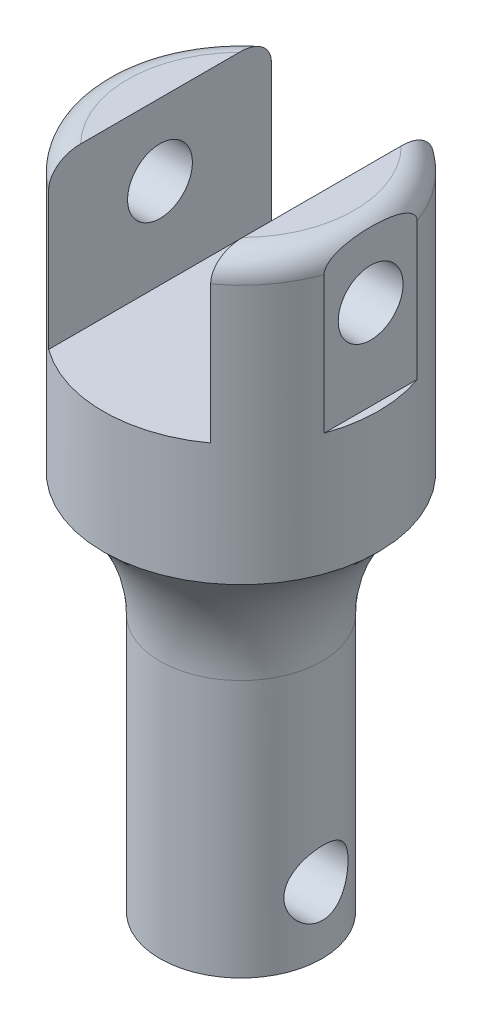
from build123d import *

# Parameters (mm, degrees)
EXTRUDE_START       = -15
SKETCH_1_R          = 17
EXTRUDE_1_DEPTH     = 35
SKETCH_2_R          = 10
EXTRUDE_2_DEPTH     = 47
FILLET_3_R          = 3
FILLET_4_R          = 20
SKETCH_4_W          = 20
SKETCH_4_H          = 21.133558335
CUT_EXTRUDE_2_DEPTH = 35
SKETCH_5_R          = 4
CUT_EXTRUDE_3_DEPTH = 35
CUT_EXTRUDE_START   = 20
SKETCH_6_W          = 15
SKETCH_6_H          = 20.573480962
CUT_EXTRUDE_4_DEPTH = 4
CUT_EXTRUDE_START_2 = -20
SKETCH_7_W          = 20
SKETCH_7_H          = 18.159164137
CUT_EXTRUDE_5_DEPTH = 4
SKETCH_8_R          = 4
CUT_EXTRUDE_6_DEPTH = 35


with BuildPart() as part:
    # Эскиз1 → Вытянуть1 (new body)
    with BuildSketch(Plane(origin=(0, 0, 0), x_dir=(1, 0, 0), z_dir=(0, 1, 0)).offset(EXTRUDE_START)):
        with Locations(Location((0, 0, 0), (0, 0, 270))):
            Circle(SKETCH_1_R)
    extrude(amount=EXTRUDE_1_DEPTH)

    # Эскиз2 → Вытянуть2 (add)
    with BuildSketch(Plane.XZ.offset(15)):
        with Locations(Location((0, 0, 0), (0, 0, 90))):
            Circle(SKETCH_2_R)
    extrude(amount=EXTRUDE_2_DEPTH)

    # Скругление3
    fillet_3_edges = [part.edges().sort_by_distance(p)[0] for p in [
        (0, 20, -17),
    ]]
    fillet(fillet_3_edges, radius=FILLET_3_R)

    # Скругление4
    # the kernel refuses this fillet: 20 mm, written as the material it adds along each edge
    with BuildSketch(Plane(origin=(0, -15, 0), x_dir=(0, 0, 1), z_dir=(1, 0, 0))) as fillet_4_piece_1:
        with BuildLine():
            CenterArc((30, 15.198684154), FILLET_4_R, 180, 49.458398126)
            Line((10, 15.198684154), (9.6, 15.198684154))
            Line((9.6, 15.198684154), (9.6, 0))
            Line((9.6, 0), (10, -0.4))
            ThreePointArc((10, -0.4), (13.5, -0.4), (16.74, -0.303973683))
            Line((16.74, -0.303973683), (17, 0))
        make_face()
    revolve(axis=Axis((0, -15, 0), (0, -1, 0)))

    # Эскиз4 → Вырез-Вытянуть2 (cut, symmetric)
    with BuildSketch(Plane.XY):
        with Locations((0, 10.566779168)):
            Rectangle(SKETCH_4_W, SKETCH_4_H)
    extrude(amount=CUT_EXTRUDE_2_DEPTH, both=True, mode=Mode.SUBTRACT)

    # Эскиз5 → Вырез-Вытянуть3 (cut, symmetric)
    with BuildSketch(Plane(origin=(0, 0, 0), x_dir=(0, 0, -1), z_dir=(1, 0, 0))):
        with Locations((0, 11.128860454)):
            Circle(SKETCH_5_R)
    extrude(amount=CUT_EXTRUDE_3_DEPTH, both=True, mode=Mode.SUBTRACT)

    # Эскиз6 → Вырез-Вытянуть4 (cut)
    with BuildSketch(Plane(origin=(0, 0, 0), x_dir=(0, 0, -1), z_dir=(1, 0, 0)).offset(CUT_EXTRUDE_START)):
        with Locations((0, 10.338040732)):
            Rectangle(SKETCH_6_W, SKETCH_6_H)
    extrude(amount=-CUT_EXTRUDE_4_DEPTH, mode=Mode.SUBTRACT)

    # Эскиз7 → Вырез-Вытянуть5 (cut)
    with BuildSketch(Plane(origin=(0, 0, 0), x_dir=(0, 0, -1), z_dir=(1, 0, 0)).offset(CUT_EXTRUDE_START_2)):
        with Locations((0, 11.708442525)):
            Rectangle(SKETCH_7_W, SKETCH_7_H)
    extrude(amount=CUT_EXTRUDE_5_DEPTH, mode=Mode.SUBTRACT)

    # Эскиз8 → Вырез-Вытянуть6 (cut, symmetric)
    with BuildSketch(Plane(origin=(0, 0, 0), x_dir=(0, 0, -1), z_dir=(1, 0, 0))):
        with Locations((0.082515947, -53.926937182)):
            Circle(SKETCH_8_R)
    extrude(amount=CUT_EXTRUDE_6_DEPTH, both=True, mode=Mode.SUBTRACT)


solid = part.part
